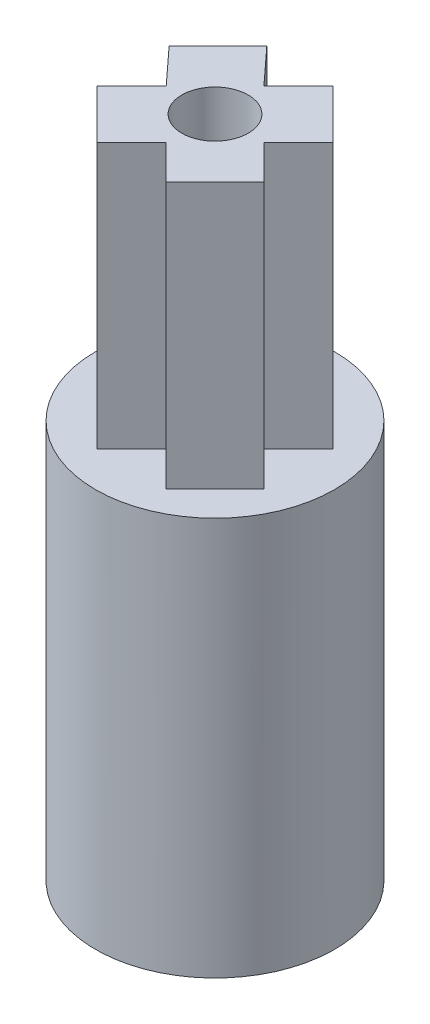
from build123d import *

# Parameters (mm, degrees)
SKETCH1_R           = 5.715
BOSS_EXTRUDE1_DEPTH = 6.35
BOSS_EXTRUDE2_START = 12.7
SKETCH3_R           = 5.715
BOSS_EXTRUDE2_DEPTH = 12.7
CUT_EXTRUDE1_DEPTH  = 12.7
BOSS_EXTRUDE3_DEPTH = 12.7
SKETCH6_R           = 1.5875
CUT_EXTRUDE2_DEPTH  = 33.762554082


with BuildPart() as part:
    # Sketch1 → Boss-Extrude1 (new body)
    with BuildSketch(Plane(origin=(0, 0, 0), x_dir=(1, 0, 0), z_dir=(0, 1, 0))):
        Circle(SKETCH1_R)
    extrude(amount=BOSS_EXTRUDE1_DEPTH)

    # Sketch3 → Boss-Extrude2 (add)
    with BuildSketch(Plane(origin=(0, 0, 0), x_dir=(-1, 0, 0), z_dir=(0, -1, 0)).offset(BOSS_EXTRUDE2_START)):
        Circle(SKETCH3_R)
    extrude(amount=-BOSS_EXTRUDE2_DEPTH)

    # Sketch4 → Cut-Extrude1 (cut)
    with BuildSketch(Plane.XZ.offset(12.7)):
        Polygon((0, 2.54), (-1.796051224, 4.336051224), (-4.336051224, 1.796051224), (-2.54, 0), (-4.336051224, -1.796051224), (-1.796051224, -4.336051224), (0, -2.54), (1.796051224, -4.336051224), (4.336051224, -1.796051224), (2.54, 0), (4.336051224, 1.796051224), (1.796051224, 4.336051224), align=None)
    extrude(amount=-CUT_EXTRUDE1_DEPTH, mode=Mode.SUBTRACT)

    # Sketch5 → Boss-Extrude3 (add)
    with BuildSketch(Plane(origin=(0, 6.35, 0), x_dir=(1, 0, 0), z_dir=(0, 1, 0))):
        Polygon((2.685e-06, 2.339735302), (1.655603957, 3.988861939), (3.990936726, 1.650595629), (2.3368, 0), (3.989167126, -1.652367126), (1.652367126, -3.989167126), (0, -2.3368), (-1.653404588, -3.98813026), (-3.988737357, -1.64986395), (-2.3368, 0.002932835), (-3.918102081, 1.723432172), (-1.581302081, 4.060232172), align=None)
    extrude(amount=BOSS_EXTRUDE3_DEPTH)

    # Sketch6 → Cut-Extrude2 (cut, through all)
    with BuildSketch(Plane(origin=(0, 19.05, 0), x_dir=(1, 0, 0), z_dir=(0, 1, 0))):
        Circle(SKETCH6_R)
    extrude(amount=-CUT_EXTRUDE2_DEPTH, mode=Mode.SUBTRACT)


solid = part.part
